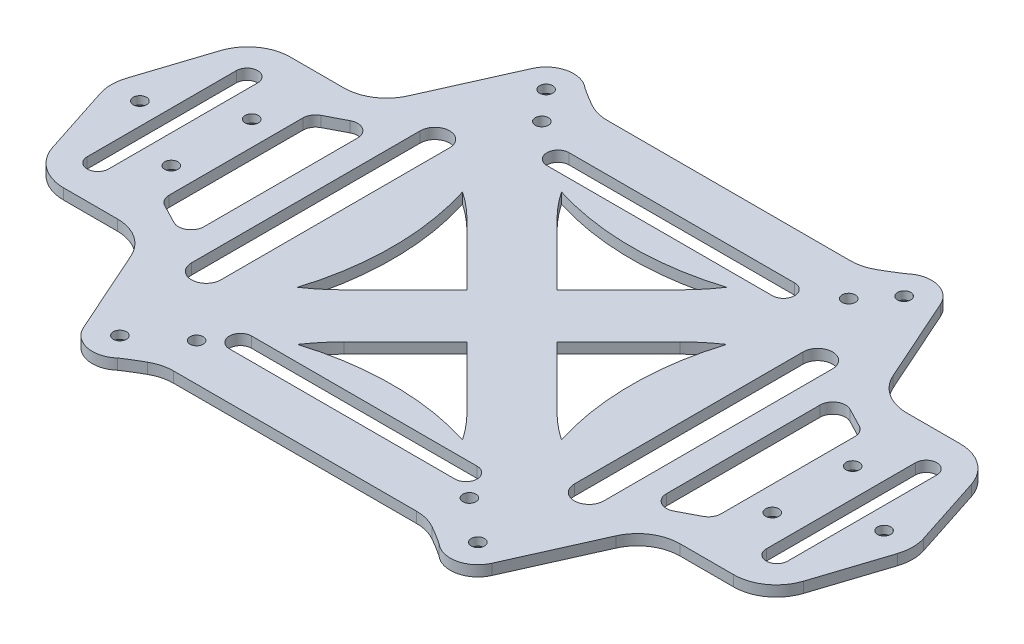
from build123d import *
from OCP.BRepFilletAPI import BRepFilletAPI_MakeChamfer

# Parameters (mm, degrees)
SKETCH_1_R             = 1.55
EXTRUDE_1_DEPTH        = 2.5
FILLET_1_R             = 10
CHAMFER_2_SIZE         = 0.615
CHAMFER_2_SIZE2        = 0.355070416
CUT_EXTRUDE_5190_DEPTH = 110.674480491
FILLET_2_R             = 3


with BuildPart() as part:
    # 草图1 → 凸台-拉伸1 (new body)
    with BuildSketch(Plane(origin=(0, 0, 0), x_dir=(1, 0, 0), z_dir=(0, 1, 0))):
        with BuildLine():
            Line((47.899982554, 52.633397656), (59.52497064, 26.588251477))
            Line((59.52497064, 26.588251477), (85.869588061, 26.588251477))
            Line((85.869588061, 26.588251477), (94.505759306, 0))
            Line((94.505759306, 0), (85.869588061, -26.588251477))
            Line((85.869588061, -26.588251477), (59.52497064, -26.588251477))
            Line((59.52497064, -26.588251477), (47.899982554, -52.633397656))
            ThreePointArc((47.899982554, -52.633397656), (43.362068791, -56.315801292), (37.709796983, -54.831018053))
            ThreePointArc((37.709796983, -54.831018053), (34.400449937, -52.764318952), (30.978168019, -50.89055015))
            Line((30.978168019, -50.89055015), (-30.978168019, -50.89055015))
            ThreePointArc((-30.978168019, -50.89055015), (-34.400449937, -52.764318952), (-37.709796983, -54.831018053))
            ThreePointArc((-37.709796983, -54.831018053), (-43.362068791, -56.315801292), (-47.899982554, -52.633397656))
            Line((-47.899982554, -52.633397656), (-59.52497064, -26.588251477))
            Line((-59.52497064, -26.588251477), (-85.869588061, -26.588251477))
            Line((-85.869588061, -26.588251477), (-94.505759306, 0))
            Line((-94.505759306, 0), (-85.869588061, 26.588251477))
            Line((-85.869588061, 26.588251477), (-59.52497064, 26.588251477))
            Line((-59.52497064, 26.588251477), (-47.899982554, 52.633397656))
            ThreePointArc((-47.899982554, 52.633397656), (-43.362068791, 56.315801292), (-37.709796983, 54.831018053))
            ThreePointArc((-37.709796983, 54.831018053), (-34.400449937, 52.764318952), (-30.978168019, 50.89055015))
            Line((-30.978168019, 50.89055015), (30.978168019, 50.89055015))
            ThreePointArc((30.978168019, 50.89055015), (34.400449937, 52.764318952), (37.709796983, 54.831018053))
            ThreePointArc((37.709796983, 54.831018053), (43.362068791, 56.315801292), (47.899982554, 52.633397656))
        make_face()
        with Locations((42, 50)):
            Circle(SKETCH_1_R, mode=Mode.SUBTRACT)
        with Locations((42, -50)):
            Circle(SKETCH_1_R, mode=Mode.SUBTRACT)
        with Locations((-42, -50)):
            Circle(SKETCH_1_R, mode=Mode.SUBTRACT)
        with Locations((-42, 50)):
            Circle(SKETCH_1_R, mode=Mode.SUBTRACT)
        with Locations((36, 43)):
            Circle(SKETCH_1_R, mode=Mode.SUBTRACT)
        with Locations((32, -42)):
            Circle(SKETCH_1_R, mode=Mode.SUBTRACT)
        with Locations((-32, -42)):
            Circle(SKETCH_1_R, mode=Mode.SUBTRACT)
        with Locations((-36, 43)):
            Circle(SKETCH_1_R, mode=Mode.SUBTRACT)
        with Locations((70.5, 9.435839055)):
            Circle(SKETCH_1_R, mode=Mode.SUBTRACT)
        with Locations((70.5, -9.435839055)):
            Circle(SKETCH_1_R, mode=Mode.SUBTRACT)
        with Locations((-70.5, -9.435839055)):
            Circle(SKETCH_1_R, mode=Mode.SUBTRACT)
        with Locations((-70.5, 9.435839055)):
            Circle(SKETCH_1_R, mode=Mode.SUBTRACT)
        with Locations((87.3, 0)):
            Circle(SKETCH_1_R, mode=Mode.SUBTRACT)
        with Locations((-87.3, 0)):
            Circle(SKETCH_1_R, mode=Mode.SUBTRACT)
        with BuildLine():
            Line((77.169642998, -17.5), (77.169642998, 17.5))
            ThreePointArc((77.169642998, 17.5), (79.669642998, 20), (82.169642998, 17.5))
            Line((82.169642998, 17.5), (82.169642998, -17.5))
            ThreePointArc((82.169642998, -17.5), (79.669642998, -20), (77.169642998, -17.5))
        make_face(mode=Mode.SUBTRACT)
        with BuildLine():
            Line((-77.169642998, -17.5), (-77.169642998, 17.5))
            ThreePointArc((-77.169642998, 17.5), (-79.669642998, 20), (-82.169642998, 17.5))
            Line((-82.169642998, 17.5), (-82.169642998, -17.5))
            ThreePointArc((-82.169642998, -17.5), (-79.669642998, -20), (-77.169642998, -17.5))
        make_face(mode=Mode.SUBTRACT)
        with BuildLine():
            Line((-24.995975583, 14.429581723), (-10.56639386, 0))
            Line((-10.56639386, 0), (-24.995975583, -14.429581723))
            ThreePointArc((-24.995975583, -14.429581723), (-27.869597938, -17.042325553), (-30.978168019, -19.370614155))
            ThreePointArc((-30.978168019, -19.370614155), (-28.024295248, 0), (-30.978168019, 19.370614155))
            ThreePointArc((-30.978168019, 19.370614155), (-27.869597938, 17.042325553), (-24.995975583, 14.429581723))
        make_face(mode=Mode.SUBTRACT)
        with BuildLine():
            Line((14.429581723, 24.995975583), (0, 10.56639386))
            Line((0, 10.56639386), (-14.429581723, 24.995975583))
            ThreePointArc((-14.429581723, 24.995975583), (-17.042325553, 27.869597938), (-19.370614155, 30.978168019))
            ThreePointArc((-19.370614155, 30.978168019), (0, 28.024295248), (19.370614155, 30.978168019))
            ThreePointArc((19.370614155, 30.978168019), (17.042325553, 27.869597938), (14.429581723, 24.995975583))
        make_face(mode=Mode.SUBTRACT)
        with BuildLine():
            Line((24.995975583, -14.429581723), (10.56639386, 0))
            Line((10.56639386, 0), (24.995975583, 14.429581723))
            ThreePointArc((24.995975583, 14.429581723), (27.869597938, 17.042325553), (30.978168019, 19.370614155))
            ThreePointArc((30.978168019, 19.370614155), (28.024295248, 0), (30.978168019, -19.370614155))
            ThreePointArc((30.978168019, -19.370614155), (27.869597938, -17.042325553), (24.995975583, -14.429581723))
        make_face(mode=Mode.SUBTRACT)
        with BuildLine():
            Line((-14.429581723, -24.995975583), (0, -10.56639386))
            Line((0, -10.56639386), (14.429581723, -24.995975583))
            ThreePointArc((14.429581723, -24.995975583), (17.042325553, -27.869597938), (19.370614155, -30.978168019))
            ThreePointArc((19.370614155, -30.978168019), (0, -28.024295248), (-19.370614155, -30.978168019))
            ThreePointArc((-19.370614155, -30.978168019), (-17.042325553, -27.869597938), (-14.429581723, -24.995975583))
        make_face(mode=Mode.SUBTRACT)
        with BuildLine():
            Line((41.468701347, -26.829343455), (41.468701347, 26.829343455))
            ThreePointArc((41.468701347, 26.829343455), (44.919200659, 30.279842767), (48.36969997, 26.829343455))
            Line((48.36969997, 26.829343455), (48.36969997, -26.829343455))
            ThreePointArc((48.36969997, -26.829343455), (44.919200659, -30.279842767), (41.468701347, -26.829343455))
        make_face(mode=Mode.SUBTRACT)
        with BuildLine():
            Line((-26.453510137, -34.636976429), (26.453510137, -34.636976429))
            ThreePointArc((26.453510137, -34.636976429), (29.060662927, -37.244129219), (26.453510137, -39.851282009))
            Line((26.453510137, -39.851282009), (-26.453510137, -39.851282009))
            ThreePointArc((-26.453510137, -39.851282009), (-29.060662927, -37.244129219), (-26.453510137, -34.636976429))
        make_face(mode=Mode.SUBTRACT)
        with BuildLine():
            Line((-26.453510137, 34.636976429), (26.453510137, 34.636976429))
            ThreePointArc((26.453510137, 34.636976429), (29.060662927, 37.244129219), (26.453510137, 39.851282009))
            Line((26.453510137, 39.851282009), (-26.453510137, 39.851282009))
            ThreePointArc((-26.453510137, 39.851282009), (-29.060662927, 37.244129219), (-26.453510137, 34.636976429))
        make_face(mode=Mode.SUBTRACT)
        with BuildLine():
            Line((-41.468701347, -26.829343455), (-41.468701347, 26.829343455))
            ThreePointArc((-41.468701347, 26.829343455), (-44.919200659, 30.279842767), (-48.36969997, 26.829343455))
            Line((-48.36969997, 26.829343455), (-48.36969997, -26.829343455))
            ThreePointArc((-48.36969997, -26.829343455), (-44.919200659, -30.279842767), (-41.468701347, -26.829343455))
        make_face(mode=Mode.SUBTRACT)
    extrude(amount=EXTRUDE_1_DEPTH)

    # 圆角1
    fillet_1_edges = [part.edges().sort_by_distance(p)[0] for p in [
        (59.52497064, 1.25, -26.588251477),
        (85.869588061, 1.25, -26.588251477),
        (85.869588061, 1.25, 26.588251477),
        (94.505759306, 1.25, 0),
        (59.52497064, 1.25, 26.588251477),
        (-59.52497064, 1.25, 26.588251477),
        (-59.52497064, 1.25, -26.588251477),
        (-85.869588061, 1.25, -26.588251477),
        (-85.869588061, 1.25, 26.588251477),
        (-94.505759306, 1.25, 0),
        (30.978168019, 1.25, -50.89055015),
        (-30.978168019, 1.25, -50.89055015),
        (30.978168019, 1.25, 50.89055015),
        (-30.978168019, 1.25, 50.89055015),
    ]]
    fillet(fillet_1_edges, radius=FILLET_1_R)

    # 倒角2: one chamfer whose edges measure the first distance from different faces: ONE call of the kernel's chamfer builder (chamfer() names one face for all edges)
    chamfer_2_edges_1 = [part.edges().sort_by_distance(p)[0] for p in [
        (-72.05, 0, 9.435839055),
    ]]
    chamfer_2_side_1 = [part.faces().sort_by_distance(p)[0] for p in [
        (-72.05, 1.25, 9.435839055),
    ]]
    chamfer_2_edges_2 = [part.edges().sort_by_distance(p)[0] for p in [
        (-72.05, 0, -9.435839055),
    ]]
    chamfer_2_side_2 = [part.faces().sort_by_distance(p)[0] for p in [
        (-72.05, 1.25, -9.435839055),
    ]]
    chamfer_2_edges_3 = [part.edges().sort_by_distance(p)[0] for p in [
        (68.95, 0, 9.435839055),
    ]]
    chamfer_2_side_3 = [part.faces().sort_by_distance(p)[0] for p in [
        (68.95, 1.25, 9.435839055),
    ]]
    chamfer_2_edges_4 = [part.edges().sort_by_distance(p)[0] for p in [
        (68.95, 0, -9.435839055),
    ]]
    chamfer_2_side_4 = [part.faces().sort_by_distance(p)[0] for p in [
        (68.95, 1.25, -9.435839055),
    ]]
    chamfer_2_edges_5 = [part.edges().sort_by_distance(p)[0] for p in [
        (-88.85, 0, 0),
    ]]
    chamfer_2_side_5 = [part.faces().sort_by_distance(p)[0] for p in [
        (-88.85, 1.25, 0),
    ]]
    chamfer_2_edges_6 = [part.edges().sort_by_distance(p)[0] for p in [
        (85.75, 0, 0),
    ]]
    chamfer_2_side_6 = [part.faces().sort_by_distance(p)[0] for p in [
        (85.75, 1.25, 0),
    ]]
    chamfer_2_edges_7 = [part.edges().sort_by_distance(p)[0] for p in [
        (-43.55, 0, 50),
    ]]
    chamfer_2_side_7 = [part.faces().sort_by_distance(p)[0] for p in [
        (-43.55, 1.25, 50),
    ]]
    chamfer_2_edges_8 = [part.edges().sort_by_distance(p)[0] for p in [
        (40.45, 0, 50),
    ]]
    chamfer_2_side_8 = [part.faces().sort_by_distance(p)[0] for p in [
        (40.45, 1.25, 50),
    ]]
    chamfer_2_edges_9 = [part.edges().sort_by_distance(p)[0] for p in [
        (-43.55, 0, -50),
    ]]
    chamfer_2_side_9 = [part.faces().sort_by_distance(p)[0] for p in [
        (-43.55, 1.25, -50),
    ]]
    chamfer_2_edges_10 = [part.edges().sort_by_distance(p)[0] for p in [
        (40.45, 0, -50),
    ]]
    chamfer_2_side_10 = [part.faces().sort_by_distance(p)[0] for p in [
        (40.45, 1.25, -50),
    ]]
    chamfer_2 = BRepFilletAPI_MakeChamfer(part.part.solid().wrapped)
    for e in chamfer_2_edges_1:
        chamfer_2.Add(CHAMFER_2_SIZE, CHAMFER_2_SIZE2, e.wrapped, chamfer_2_side_1[0].wrapped)  # the first distance lies on this face
    for e in chamfer_2_edges_2:
        chamfer_2.Add(CHAMFER_2_SIZE, CHAMFER_2_SIZE2, e.wrapped, chamfer_2_side_2[0].wrapped)  # the first distance lies on this face
    for e in chamfer_2_edges_3:
        chamfer_2.Add(CHAMFER_2_SIZE, CHAMFER_2_SIZE2, e.wrapped, chamfer_2_side_3[0].wrapped)  # the first distance lies on this face
    for e in chamfer_2_edges_4:
        chamfer_2.Add(CHAMFER_2_SIZE, CHAMFER_2_SIZE2, e.wrapped, chamfer_2_side_4[0].wrapped)  # the first distance lies on this face
    for e in chamfer_2_edges_5:
        chamfer_2.Add(CHAMFER_2_SIZE, CHAMFER_2_SIZE2, e.wrapped, chamfer_2_side_5[0].wrapped)  # the first distance lies on this face
    for e in chamfer_2_edges_6:
        chamfer_2.Add(CHAMFER_2_SIZE, CHAMFER_2_SIZE2, e.wrapped, chamfer_2_side_6[0].wrapped)  # the first distance lies on this face
    for e in chamfer_2_edges_7:
        chamfer_2.Add(CHAMFER_2_SIZE, CHAMFER_2_SIZE2, e.wrapped, chamfer_2_side_7[0].wrapped)  # the first distance lies on this face
    for e in chamfer_2_edges_8:
        chamfer_2.Add(CHAMFER_2_SIZE, CHAMFER_2_SIZE2, e.wrapped, chamfer_2_side_8[0].wrapped)  # the first distance lies on this face
    for e in chamfer_2_edges_9:
        chamfer_2.Add(CHAMFER_2_SIZE, CHAMFER_2_SIZE2, e.wrapped, chamfer_2_side_9[0].wrapped)  # the first distance lies on this face
    for e in chamfer_2_edges_10:
        chamfer_2.Add(CHAMFER_2_SIZE, CHAMFER_2_SIZE2, e.wrapped, chamfer_2_side_10[0].wrapped)  # the first distance lies on this face
    add(Compound.cast(chamfer_2.Shape()), mode=Mode.REPLACE)

    # Sketch 4946 → Cut-Extrude 5190 (cut, through all)
    with BuildSketch(Plane.XZ):
        Polygon((-64.75, 17.5), (-54.25, 22.965954031), (-54.25, -22.965954031), (-64.75, -17.5), align=None)
        Polygon((54.25, -22.965954031), (64.75, -17.5), (64.75, 17.5), (54.25, 22.965954031), align=None)
    extrude(amount=-CUT_EXTRUDE_5190_DEPTH, mode=Mode.SUBTRACT)

    # 圆角2
    fillet_2_edges = [part.edges().sort_by_distance(p)[0] for p in [
        (64.75, 1.25, 17.5),
        (64.75, 1.25, -17.5),
        (54.25, 1.25, -22.965954031),
        (54.25, 1.25, 22.965954031),
        (-54.25, 1.25, -22.965954031),
        (-64.75, 1.25, -17.5),
        (-64.75, 1.25, 17.5),
        (-54.25, 1.25, 22.965954031),
    ]]
    fillet(fillet_2_edges, radius=FILLET_2_R)


solid = part.part
